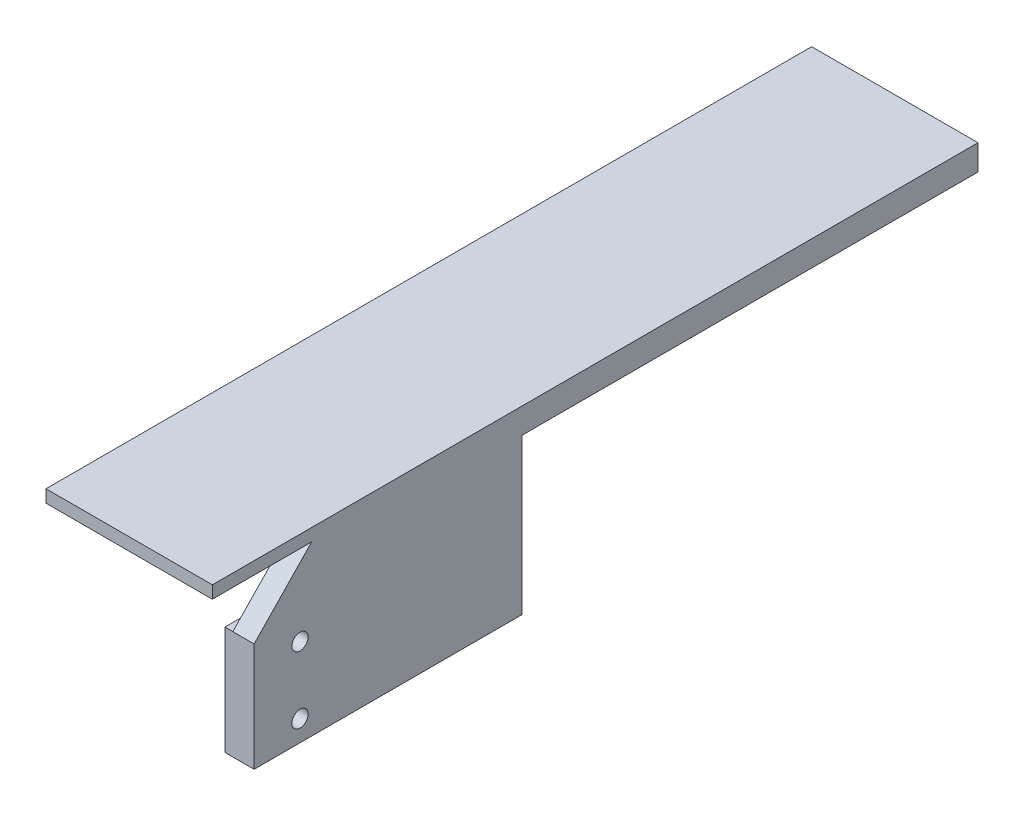
from build123d import *

# Parameters (mm, degrees)
LEG_AND_PAD_DEPTH                     = 13
SCREW_HEAD_RELIEF_SKETCH_W            = 14
SCREW_HEAD_RELIEF_SKETCH_H            = 6
SCREW_HEAD_RELIEF_DEPTH               = 2.35
M6_SLOT_MIDDLE_DEPTH                  = 3.5
SCREW_HOLES_SKETCH_R                  = 1.95
SCREW_HOLES_DEPTH                     = 4.5
FOOT_LEG_DEPTH                        = 6.1
SOLE_UNDER_THE_HOUSING_SKETCH_W       = 39.841788068
SOLE_UNDER_THE_HOUSING_SKETCH_H       = 155.03
SOLE_UNDER_THE_HOUSING_DEPTH          = 3.035
SOLE_UNDER_THE_BLOCK_SKETCH_W         = 39.841788068
SOLE_UNDER_THE_BLOCK_SKETCH_H         = 28.84
SOLE_UNDER_THE_BLOCK_DEPTH            = 1.5
SEAT_GUSSET_DEPTH                     = 2.55
TAIL_RIB_DEPTH                        = 3
SCREW_HEAD_RELIEF_TO_THE_END_SKETCH_W = 14
SCREW_HEAD_RELIEF_TO_THE_END_SKETCH_H = 16
SCREW_HEAD_RELIEF_TO_THE_END_DEPTH    = 2.35


with BuildPart() as part:
    # leg and pad sketch → leg and pad (new, symmetric)
    with BuildSketch(Plane(origin=(0, -20.7, 0), x_dir=(1, 0, 0), z_dir=(0, 1, 0))):
        Polygon((-0.551289683, 30.332713936), (-0.367250577, 30.819395741), (-0.028023026, 31.213926146), (0.425575667, 31.468833575), (0.938966578, 31.553446481), (1.450376329, 31.457583879), (1.898269923, 31.192780366), (2.228754897, 30.790898227), (2.402065893, 30.30029363), (2.397349395, 29.779998208), (2.215172912, 29.292616119), (1.877456693, 28.896791249), (1.424836191, 28.640150931), (0.91177263, 28.55357522), (0.4, 28.647481273), (0.4, -9.98), (1.92, -11.5), (1.92, -31.37), (8.92, -31.37), (8.92, 32.792642706), (-27.204821487, 54.594667874), (-30.821788068, 48.601542416), align=None)
    extrude(amount=LEG_AND_PAD_DEPTH, both=True)

    # screw head relief sketch → screw head relief (cut, symmetric)
    with BuildSketch(Plane(origin=(1.35, 0, 0), x_dir=(0, 0, -1), z_dir=(1, 0, 0))):
        with Locations((16.4, -9.7)):
            Rectangle(SCREW_HEAD_RELIEF_SKETCH_W, SCREW_HEAD_RELIEF_SKETCH_H)
    extrude(amount=SCREW_HEAD_RELIEF_DEPTH, both=True, mode=Mode.SUBTRACT)

    # insert flange relief sketch → insert flange relief (revolve, cut)
    with BuildSketch(Plane(origin=(0, -20.7, 0), x_dir=(1, 0, 0), z_dir=(0, 1, 0))):
        Polygon((-18.324853729, 39.891397061), (-17.03307995, 42.03179901), (-9.755713323, 37.639768162), (-11.047487102, 35.499366213), align=None)
    revolve(axis=Axis((-18.324853729, -20.7, -39.891397061), (0.5167095115681243, 0, -0.8561607796757748)), mode=Mode.SUBTRACT)

    # M6 slot end 1 sketch → M6 slot end 1 (revolve, cut)
    with BuildSketch(Plane(origin=(0, -20.7, 0), x_dir=(1, 0, 0), z_dir=(0, 1, 0))):
        Polygon((-20.893336068, 41.441525596), (-16.242950464, 49.146972613), (-13.246387735, 47.338489322), (-17.896773339, 39.633042305), align=None)
    revolve(axis=Axis((-20.893336068, -20.7, -41.441525596), (0.5167095115681233, 0, -0.8561607796757753)), mode=Mode.SUBTRACT)

    # M6 slot end 2 sketch → M6 slot end 2 (revolve, cut)
    with BuildSketch(Plane(origin=(0, -20.7, 0), x_dir=(1, 0, 0), z_dir=(0, 1, 0))):
        Polygon((-15.75637139, 38.341268526), (-11.105985786, 46.046715543), (-8.109423057, 44.238232253), (-12.759808661, 36.532785236), align=None)
    revolve(axis=Axis((-15.75637139, -20.7, -38.341268526), (0.5167095115681234, 0, -0.8561607796757752)), mode=Mode.SUBTRACT)

    # M6 slot middle sketch → M6 slot middle (cut, symmetric)
    with BuildSketch(Plane(origin=(0, -20.7, 0), x_dir=(1, 0, 0), z_dir=(0, 1, 0))):
        Polygon((-15.75637139, 38.341268526), (-20.893336068, 41.441525596), (-16.242950464, 49.146972613), (-11.105985786, 46.046715543), align=None)
    extrude(amount=M6_SLOT_MIDDLE_DEPTH, both=True, mode=Mode.SUBTRACT)

    # screw holes sketch → screw holes (cut, symmetric)
    with BuildSketch(Plane(origin=(5.42, 0, 0), x_dir=(0, 0, -1), z_dir=(1, 0, 0))):
        with Locations((-20.375, -28.7)):
            Circle(SCREW_HOLES_SKETCH_R)
        with Locations((-20.375, -12.7)):
            Circle(SCREW_HOLES_SKETCH_R)
    extrude(amount=SCREW_HOLES_DEPTH, both=True, mode=Mode.SUBTRACT)

    # foot leg sketch → foot leg (add, symmetric)
    with BuildSketch(Plane(origin=(0, -2.1, 0), x_dir=(1, 0, 0), z_dir=(0, 1, 0))):
        Polygon((2.3, 30.013511625), (2.3, -9.98), (8.92, -9.98), (8.92, 32.792642706), (-27.204821487, 54.594667874), (-30.201736654, 49.628935352), align=None)
    extrude(amount=FOOT_LEG_DEPTH, both=True)

    # sole under the housing sketch → sole under the housing (add, symmetric)
    with BuildSketch(Plane(origin=(0, 6.535, 0), x_dir=(1, 0, 0), z_dir=(0, 1, 0))):
        with Locations((-11.000894034, 64.485)):
            Rectangle(SOLE_UNDER_THE_HOUSING_SKETCH_W, SOLE_UNDER_THE_HOUSING_SKETCH_H)
    extrude(amount=SOLE_UNDER_THE_HOUSING_DEPTH, both=True)

    # sole under the block sketch → sole under the block (add, symmetric)
    with BuildSketch(Plane(origin=(0, 8.07, 0), x_dir=(1, 0, 0), z_dir=(0, 1, 0))):
        with Locations((-11.000894034, -26.95)):
            Rectangle(SOLE_UNDER_THE_BLOCK_SKETCH_W, SOLE_UNDER_THE_BLOCK_SKETCH_H)
    extrude(amount=SOLE_UNDER_THE_BLOCK_DEPTH, both=True)

    # seat gusset sketch → seat gusset (add, symmetric)
    with BuildSketch(Plane(origin=(6.37, 0, 0), x_dir=(0, 0, -1), z_dir=(1, 0, 0))):
        Polygon((-9.48, -8.2), (-31.37, -8.2), (-31.37, -7.7), (-17.1, 7.07), (-9.48, 7.07), align=None)
    extrude(amount=SEAT_GUSSET_DEPTH, both=True)

    # tail rib sketch → tail rib (add, symmetric)
    with BuildSketch(Plane(origin=(-19.921788068, 0, 0), x_dir=(0, 0, -1), z_dir=(1, 0, 0))):
        Polygon((53.1, 4), (53.1, -12.5), (57.1, -12.5), (140, 3.5), (140, 4), align=None)
    extrude(amount=TAIL_RIB_DEPTH, both=True)

    # screw head relief to the end sketch → screw head relief to the end (cut, symmetric)
    with BuildSketch(Plane(origin=(1.35, 0, 0), x_dir=(0, 0, -1), z_dir=(1, 0, 0))):
        with Locations((16.4, -4.7)):
            Rectangle(SCREW_HEAD_RELIEF_TO_THE_END_SKETCH_W, SCREW_HEAD_RELIEF_TO_THE_END_SKETCH_H)
    extrude(amount=SCREW_HEAD_RELIEF_TO_THE_END_DEPTH, both=True, mode=Mode.SUBTRACT)


solid = part.part
